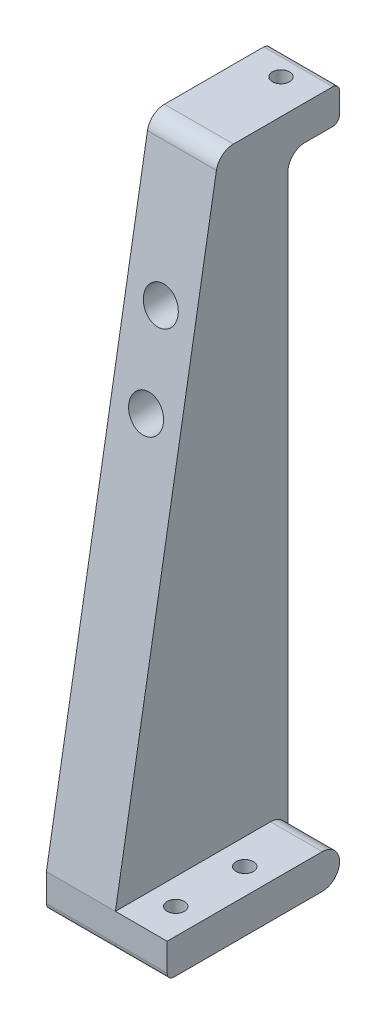
from build123d import *

# Parameters (mm, degrees)
SKETCH3_W           = 38.1
SKETCH3_H           = 12.7
SKETCH3_W_2         = 19.05
BOSS_EXTRUDE1_DEPTH = 25.4
FILLET1_R           = 6.35
FILLET3_R           = 2.54
SKETCH9_R           = 3.175
CUT_EXTRUDE2_DEPTH  = 243.42109467
SKETCH10_R          = 3.225000027
SKETCH10_R_2        = 3.180000003
CUT_EXTRUDE3_DEPTH  = 137.245942271
SKETCH18_R          = 6.35
CUT_EXTRUDE4_DEPTH  = 38.1
SKETCH19_W          = 19.05
SKETCH19_H          = 63.5
SKETCH19_R          = 3.175
BOSS_EXTRUDE4_DEPTH = 12.7
FILLET6_R           = 2.54
FILLET7_R           = 6.35


with BuildPart() as part:
    # Sketch3 → Boss-Extrude1 (new body)
    with BuildSketch(Plane(origin=(0, 0, 0), x_dir=(0, 0, -1), z_dir=(1, 0, 0))):
        Polygon((-12.7, -105.13695), (-12.7, -117.83695), (12.7, -117.83695), (12.7, 105.13695), (12.7, 117.83695), (-12.7, 117.83695), (-50.8, -105.13695), align=None)
        with Locations((-31.75, -111.48695)):
            Rectangle(SKETCH3_W, SKETCH3_H)
        with Locations((22.225, 111.48695)):
            Rectangle(SKETCH3_W_2, SKETCH3_H)
    extrude(amount=BOSS_EXTRUDE1_DEPTH)

    # Fillet1
    fillet1_edges = [part.edges().sort_by_distance(p)[0] for p in [
        (12.7, 105.13695, -12.7),
        (12.7, -117.83695, -12.7),
        (12.7, 117.83695, 12.7),
    ]]
    fillet(fillet1_edges, radius=FILLET1_R)

    # Fillet3
    fillet3_edges = [part.edges().sort_by_distance(p)[0] for p in [
        (12.7, 117.83695, -31.75),
        (12.7, 105.13695, -31.75),
        (12.7, -117.83695, 50.8),
    ]]
    fillet(fillet3_edges, radius=FILLET3_R)

    # Sketch9 → Cut-Extrude2 (cut, through all)
    with BuildSketch(Plane(origin=(0, 117.83695, 0), x_dir=(1, 0, 0), z_dir=(0, 1, 0))):
        with Locations(Location((12.7, 22.86, 0), (0, 0, 270))):
            Circle(SKETCH9_R)
    extrude(amount=-CUT_EXTRUDE2_DEPTH, mode=Mode.SUBTRACT)

    # Sketch10 → Cut-Extrude3 (cut, through all)
    with BuildSketch(Plane(origin=(0, 0, -12.7), x_dir=(-1, 0, 0), z_dir=(0, 0, -1))):
        with Locations((-12.7, 35.28695)):
            Circle(SKETCH10_R)
        with Locations((-12.7, 67.03695)):
            Circle(SKETCH10_R_2)
    extrude(amount=-CUT_EXTRUDE3_DEPTH, mode=Mode.SUBTRACT)

    # Sketch18 → Cut-Extrude4 (cut)
    with BuildSketch(Plane(origin=(0, 0, 38.1), x_dir=(-1, 0, 0), z_dir=(0, 0, -1))):
        with Locations(Location((-12.7, 67.03695, 0), (0, 0, 270))):
            Circle(SKETCH18_R)
        with Locations(Location((-12.7, 35.28695, 0), (0, 0, 270))):
            Circle(SKETCH18_R)
    extrude(amount=CUT_EXTRUDE4_DEPTH, mode=Mode.SUBTRACT)

    # Sketch19 → Boss-Extrude4 (add)
    with BuildSketch(Plane.XZ.offset(117.83695)):
        with Locations((34.925, 19.05)):
            Rectangle(SKETCH19_W, SKETCH19_H)
        with Locations(Location((34.925, 38.1, 0), (0, 0, 270))):
            Circle(SKETCH19_R, mode=Mode.SUBTRACT)
        with Locations(Location((34.925, 12.7, 0), (0, 0, 270))):
            Circle(SKETCH19_R, mode=Mode.SUBTRACT)
    extrude(amount=-BOSS_EXTRUDE4_DEPTH)

    # Fillet6
    fillet6_edges = [part.edges().sort_by_distance(p)[0] for p in [
        (34.925, -117.83695, 50.8),
    ]]
    fillet(fillet6_edges, radius=FILLET6_R)

    # Fillet7
    # the kernel refuses this fillet: 6.35 mm, written as the material it takes off along each edge
    with BuildSketch(Plane(origin=(9.525, -117.83695, -12.7), x_dir=(0, 0, 1), z_dir=(1, 0, 0))) as fillet7_piece_1:
        with BuildLine():
            CenterArc((FILLET7_R, -FILLET7_R), FILLET7_R, 90, 90)
            Line((0, -FILLET7_R), (0, 0))
            Line((0, 0), (FILLET7_R, 0))
        make_face()
    extrude(amount=50.8, mode=Mode.SUBTRACT)
    with BuildSketch(Plane(origin=(25.4, -105.13695, -12.7), x_dir=(0, 0, 1), z_dir=(1, 0, 0))) as fillet7_piece_2:
        with BuildLine():
            CenterArc((FILLET7_R, FILLET7_R), FILLET7_R, 180, 90)
            Line((0, FILLET7_R), (0, 0))
            Line((0, 0), (FILLET7_R, 0))
        make_face()
    extrude(amount=34.925, mode=Mode.SUBTRACT)


solid = part.part
